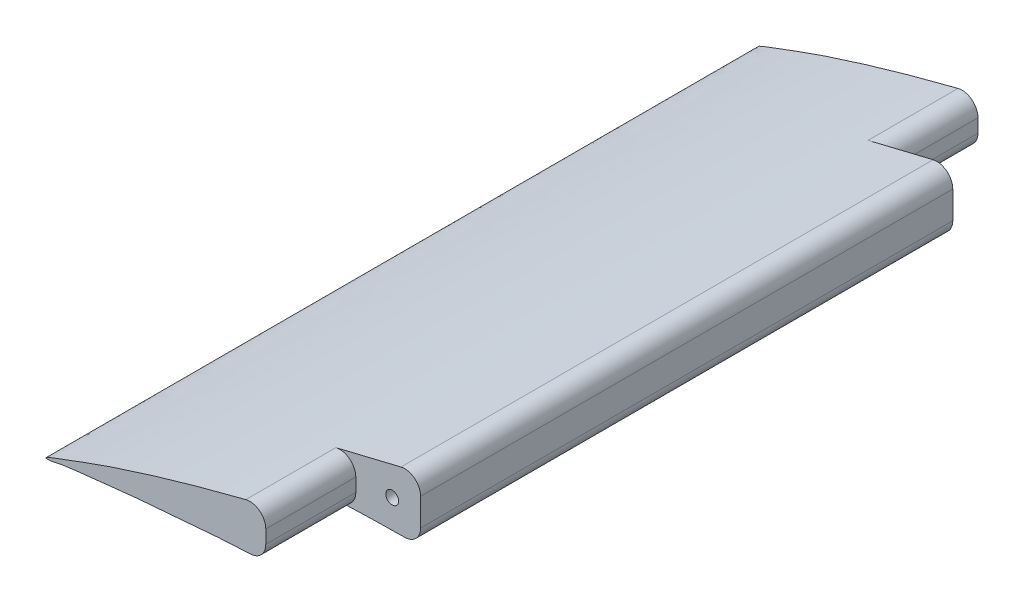
from build123d import *

# Parameters (mm, degrees)
BOSS_EXTRUDE1_DEPTH       = 226.06
CUT_EXTRUDE1_DEPTH        = 248.603669875
CUT_EXTRUDE1_DEPTH_BACK   = 248.603669875
FILLET1_R                 = 5.08
SHELL1_START              = 31.75
SHELL1_DEPTH              = 162.56
SHELL1_START_2            = 3.175
SHELL1_2_DEPTH            = 219.71
SKETCH3_R                 = 2.032
CUT_EXTRUDE2_DEPTH        = 246.233624371
BOSS_EXTRUDE2_START       = -4.025198094
BOSS_EXTRUDE2_OUTLINE_R   = 1.5875
BOSS_EXTRUDE2_DEPTH       = 5.811624811
BOSS_EXTRUDE2_START_2     = -8.955775483
BOSS_EXTRUDE2_2_OUTLINE_R = 1.5875
BOSS_EXTRUDE2_2_DEPTH     = 4.930577389


# Read off the part's stored shape, not the designer's step: Shell1, Boss-Extrude2
with BuildPart() as part:
    # Sketch1 → Boss-Extrude1 (new body)
    with BuildSketch(Plane.XY):
        with BuildLine():
            Line((99.32639085, 18.404394796), (99.32639085, -2.986448862))
            add(Edge.make_bspline(
                [(5.047603806, -9.653713384), (9.482649657, -8.546128483), (16.988483729, -8.076906091), (30.336595099, -6.254410192), (41.946659702, -5.566037344), (65.865842143, -3.231342143), (83.974811725, -3.089086557), (99.32639085, -2.986448862)],
                knots=[0, 0, 0, 0, 0.144322392, 0.237947652, 0.42712275, 0.512831912, 1, 1, 1, 1], degree=3))
            add(Edge.make_bspline(
                [(5.047603806, -9.653713384), (1.304537033, -10.042523479), (11.503328192, -6.353494655), (19.723627138, -3.092777487), (52.915151131, 7.645918304), (77.889766355, 13.460013374), (99.32639085, 18.404394796)],
                knots=[0, 0, 0, 0, 0.059914523, 0.175786391, 0.369274689, 1, 1, 1, 1], degree=3))
        make_face()
    extrude(amount=BOSS_EXTRUDE1_DEPTH)

    # Sketch2 → Cut-Extrude1 (cut, two sides: drawn at the far end of the back side and taken through both)
    with BuildSketch(Plane(origin=(0, 0, 0), x_dir=(1, 0, 0), z_dir=(0, 1, 0)).offset(-CUT_EXTRUDE1_DEPTH_BACK)):
        Polygon((169.681502528, 0), (169.681502528, -226.06), (73.16439085, -226.06), (73.16439085, -197.485), (93.73839085, -197.485), (93.73839085, -28.575), (73.16439085, -28.575), (73.16439085, 0), align=None)
    extrude(amount=CUT_EXTRUDE1_DEPTH + CUT_EXTRUDE1_DEPTH_BACK, mode=Mode.SUBTRACT)

    # Fillet1
    fillet1_edges = [part.edges().sort_by_distance(p)[0] for p in [
        (73.16439085, -3.388889971, 14.2875),
        (73.16439085, 12.236004014, 14.2875),
        (93.73839085, -3.026654485, 113.03),
        (93.73839085, 17.113551214, 113.03),
        (73.16439085, -3.388889971, 211.7725),
        (73.16439085, 12.236004014, 211.7725),
    ]]
    fillet(fillet1_edges, radius=FILLET1_R)

    # Shell1 outline → Shell1 (cut)
    with BuildSketch(Plane.XY.offset(SHELL1_START)):
        with BuildLine():
            ThreePointArc((90.56339085, 10.716231692), (89.84210345, 12.208829924), (88.224441264, 12.571147528))
            add(Edge.make_bspline(
                [(88.224441264, 12.571147528), (87.199954726, 12.331473265), (86.178161178, 12.091844736), (85.158893539, 11.852170354), (84.141984638, 11.612358579), (83.127267128, 11.372317854), (82.11457348, 11.131956606), (81.103735991, 10.891183246), (80.094586779, 10.649906167), (79.086957782, 10.408033746), (78.080680762, 10.165474344), (77.075587303, 9.922136302), (75.365261077, 9.50615692), (74.659515429, 9.333955274), (73.95421322, 9.161291111), (73.24929575, 8.988132524), (72.544704275, 8.814447596), (71.84038, 8.640204402), (71.136264087, 8.465371009), (70.432297655, 8.289915474), (69.728421779, 8.113805846), (69.024577498, 7.937010164), (68.320705808, 7.759496459), (67.616747671, 7.581232754)],
                knots=[0.118068853, 0.118068853, 0.118068853, 0.118068853, 0.118068853, 0.118068853, 0.118068853, 0.118068853, 0.118068853, 0.118068853, 0.118068853, 0.118068853, 0.118068853, 0.242924315, 0.242924315, 0.242924315, 0.242924315, 0.242924315, 0.242924315, 0.242924315, 0.242924315, 0.242924315, 0.242924315, 0.242924315, 0.330745026, 0.330745026, 0.330745026, 0.330745026, 0.330745026, 0.330745026, 0.330745026, 0.330745026, 0.330745026, 0.330745026, 0.330745026, 0.330745026, 0.330745026], degree=12))
            ThreePointArc((67.616747671, 7.581232754), (69.254468773, 7.237834237), (69.98939085, 5.734523672))
            Line((69.98939085, 5.734523672), (69.98939085, 1.506513014))
            ThreePointArc((69.98939085, 1.506513014), (69.459523341, 0.188167221), (68.164681525, -0.396794214))
            add(Edge.make_bspline(
                [(68.164681525, -0.396794214), (68.694992172, -0.374423154), (69.225275053, -0.352727917), (69.755528584, -0.331695291), (70.285751179, -0.311312074), (70.815941255, -0.291565067), (71.346097229, -0.272441078), (71.876217523, -0.25392692), (72.406300557, -0.236009412), (72.936344753, -0.218675382), (73.466348538, -0.201911658), (73.996310335, -0.18570508), (74.526228574, -0.170042489), (75.056101682, -0.154910735), (76.522372139, -0.114466983), (77.45867021, -0.090254504), (78.394813662, -0.06758666), (79.330793845, -0.046390933), (80.266602102, -0.026594862), (81.202229769, -0.008126042), (82.137668173, 0.009087874), (83.072908636, 0.025119175), (84.007942471, 0.040040096), (84.942760983, 0.053922812), (85.87735547, 0.066839443), (86.811717225, 0.07886205), (87.74583753, 0.09006264), (88.679707661, 0.100513159)],
                knots=[0.67202474, 0.67202474, 0.67202474, 0.67202474, 0.67202474, 0.67202474, 0.67202474, 0.67202474, 0.67202474, 0.67202474, 0.67202474, 0.67202474, 0.67202474, 0.67202474, 0.67202474, 0.75, 0.75, 0.75, 0.75, 0.75, 0.75, 0.75, 0.75, 0.75, 0.75, 0.75, 0.75, 0.75, 0.887817721, 0.887817721, 0.887817721, 0.887817721, 0.887817721, 0.887817721, 0.887817721, 0.887817721, 0.887817721, 0.887817721, 0.887817721, 0.887817721, 0.887817721, 0.887817721, 0.887817721], degree=14))
            ThreePointArc((88.679707661, 0.100513159), (90.012944885, 0.665913267), (90.56339085, 2.0053939))
            Line((90.56339085, 2.0053939), (90.56339085, 10.716231692))
        make_face()
        with BuildLine():
            ThreePointArc((69.98939085, 5.734523672), (69.254468773, 7.237834237), (67.616747644, 7.581232862))
            add(Edge.make_bspline(
                [(67.616747644, 7.581232862), (65.399836461, 7.019843113), (63.182067917, 6.451015332), (60.961598132, 5.873750666), (58.736579605, 5.2870495), (56.505161763, 4.689911333), (54.265491496, 4.081334769), (52.015713682, 3.460317509), (49.753971716, 2.825856339), (47.478408044, 2.176947117), (45.187164685, 1.512584769), (42.878383765, 0.831763272), (40.358491497, 0.075974277), (40.166643435, 0.018354472), (39.974662823, -0.039384328), (39.782548624, -0.097242688), (39.590299803, -0.155221168), (39.397915321, -0.213320331), (39.205394144, -0.271540739), (39.012735233, -0.329882954), (38.819937552, -0.388347539), (38.627000064, -0.446935056), (38.433921733, -0.505646067), (38.047481311, -0.6233162), (37.854115889, -0.68227633), (37.660618706, -0.741357704), (37.46700324, -0.800556496), (37.273282999, -0.859868869), (37.079471514, -0.919290978), (36.885582349, -0.97881897), (36.69162909, -1.038448983), (36.497625354, -1.098177145), (36.303584785, -1.157999576), (36.109521054, -1.217912388), (35.527301471, -1.397910273), (35.139116839, -1.518254909), (34.751002758, -1.638914656), (34.363068079, -1.759858551), (33.975421705, -1.881055606), (33.588172595, -2.002474805), (33.20142976, -2.124085105), (32.815302268, -2.245855438), (32.429899238, -2.367754709), (32.045329846, -2.489751794), (31.66170332, -2.611815547), (31.123971117, -2.783433666), (30.968986334, -2.832958389), (30.814181899, -2.882486873), (30.659565113, -2.93201703), (30.505143284, -2.981546776), (30.350923715, -3.031074022), (30.196913716, -3.080596682), (30.043120596, -3.130112665), (29.889551668, -3.179619883), (29.736214245, -3.229116246), (29.583115647, -3.27859966), (29.430263192, -3.328068033)],
                knots=[0.330745026, 0.330745026, 0.330745026, 0.330745026, 0.330745026, 0.330745026, 0.330745026, 0.330745026, 0.330745026, 0.330745026, 0.330745026, 0.330745026, 0.330745026, 0.607310788, 0.607310788, 0.607310788, 0.607310788, 0.607310788, 0.607310788, 0.607310788, 0.607310788, 0.607310788, 0.607310788, 0.607310788, 0.630084943, 0.630084943, 0.630084943, 0.630084943, 0.630084943, 0.630084943, 0.630084943, 0.630084943, 0.630084943, 0.630084943, 0.630084943, 0.652859097, 0.652859097, 0.652859097, 0.652859097, 0.652859097, 0.652859097, 0.652859097, 0.652859097, 0.652859097, 0.652859097, 0.652859097, 0.698407406, 0.698407406, 0.698407406, 0.698407406, 0.698407406, 0.698407406, 0.698407406, 0.698407406, 0.698407406, 0.698407406, 0.698407406, 0.716880093, 0.716880093, 0.716880093, 0.716880093, 0.716880093, 0.716880093, 0.716880093, 0.716880093, 0.716880093, 0.716880093, 0.716880093, 0.716880093, 0.716880093], degree=12))
            add(Edge.make_bspline(
                [(29.430263192, -3.328068033), (30.192321788, -3.253103705), (30.953742852, -3.181055792), (31.714498333, -3.111652976), (32.474560286, -3.044625223), (33.233901052, -2.979703638), (33.992493217, -2.916620464), (34.750309569, -2.855109092), (35.507323058, -2.794904058), (36.26350675, -2.735741051), (37.018833789, -2.677356913), (37.77327735, -2.619489644), (38.526810601, -2.561878406), (39.27940666, -2.504263523), (40.241275886, -2.430197827), (40.451437795, -2.413988578), (40.661523692, -2.397753121), (40.871532992, -2.381485838), (41.081465111, -2.36518111), (41.291319462, -2.34883332), (41.501095461, -2.332436848), (41.710792523, -2.315986075), (41.920410064, -2.299475384), (42.129947497, -2.282899155), (42.339404239, -2.266251771), (42.548779704, -2.249527611), (42.758073307, -2.232721059), (43.071890042, -2.207379213), (43.176475009, -2.198909942), (43.281039293, -2.190417989), (43.38558282, -2.181902656), (43.490105518, -2.173363251), (43.594607315, -2.164799076), (43.699088138, -2.156209439), (43.803547915, -2.147593642), (43.907986571, -2.138950992), (44.012404037, -2.130280793), (44.116800238, -2.12158235), (44.221175102, -2.112854969), (44.325528557, -2.104097954), (44.482026516, -2.090916937), (44.534185416, -2.08651578), (44.586353102, -2.082106088), (44.638462372, -2.077692142), (44.690677468, -2.073262507), (44.74276457, -2.068834253), (44.79486261, -2.064396055), (44.84709011, -2.05993977), (44.899190406, -2.055485443), (44.951182515, -2.051030032), (45.003429676, -2.046545196), (45.055514905, -2.042065555), (45.107662823, -2.037572174), (45.211955574, -2.028569312), (45.264108442, -2.024059127), (45.316267814, -2.019540326), (45.368433702, -2.015013048), (45.42060612, -2.010477431), (45.472785076, -2.005933613), (45.524970589, -2.001381732), (45.577162664, -1.996821927), (45.629361319, -1.992254336), (45.681566563, -1.987679097), (45.73377841, -1.983096348), (45.785996871, -1.978506228), (45.838221958, -1.973908876), (46.3083075, -1.93246885), (46.726586222, -1.895179261), (47.145296128, -1.857506655), (47.564443519, -1.819522312), (47.98403472, -1.781297798), (48.404076086, -1.742904961), (48.824573993, -1.704415937), (49.24553485, -1.665903148), (49.66696508, -1.627439299), (50.088871145, -1.589097383), (50.511259522, -1.550950675), (50.934136722, -1.513072738), (51.357509275, -1.47553742), (51.834368049, -1.433779033), (51.8873602, -1.429145723), (51.940360205, -1.424519069), (51.993368079, -1.419899217), (52.046383832, -1.415286311), (52.099407479, -1.410680497), (52.152439032, -1.40608192), (52.205478504, -1.401490725), (52.258525908, -1.396907058), (52.311581256, -1.392331062), (52.364644562, -1.387762884), (52.417715838, -1.38320267), (52.470795096, -1.378650563), (52.576969604, -1.369562855), (52.630062039, -1.365027462), (52.683179331, -1.360499209), (52.736263003, -1.355982684), (52.78940087, -1.351471194), (52.842545574, -1.346968801), (52.895651993, -1.342479031), (52.948780943, -1.337996995), (53.001972248, -1.333519945), (53.055147327, -1.329054684), (53.108262643, -1.324604451), (53.161436979, -1.320159017), (53.214588182, -1.31572572), (53.37405314, -1.302454763), (53.48036356, -1.293647424), (53.586674415, -1.284879943), (53.692985692, -1.276152212), (53.799297377, -1.267464124), (53.905609457, -1.258815573), (54.011921919, -1.25020645), (54.118234749, -1.241636649), (54.224547934, -1.233106063), (54.330861461, -1.224614583), (54.437175316, -1.216162103), (54.543489487, -1.207748516), (54.649803959, -1.199373714), (54.96874824, -1.174365343), (55.181378913, -1.157847807), (55.394010633, -1.141484125), (55.606643294, -1.125273441), (55.819276791, -1.109214898), (56.031911017, -1.093307639), (56.244545869, -1.077550807), (56.457181238, -1.061943545), (56.669817021, -1.046484998), (56.882453112, -1.031174307), (57.095089404, -1.016010616), (57.307725793, -1.000993068), (57.520362172, -0.986120806), (58.158270965, -0.941937311), (58.583543022, -0.913059346), (59.008813776, -0.884752245), (59.434082397, -0.857009171), (59.859348051, -0.829823289), (60.284609909, -0.803187765), (60.709867137, -0.777095761), (61.135118907, -0.751540443), (61.560364383, -0.726514975), (61.985602738, -0.702012521), (62.410833137, -0.678026246), (62.83605475, -0.654549315), (63.261266746, -0.631574892), (64.006388166, -0.592183223), (64.32630213, -0.575550919), (64.646209835, -0.559196323), (64.96611093, -0.543116532), (65.286005067, -0.527308639), (65.605891895, -0.511769741), (65.925771064, -0.496496937), (66.245642227, -0.481487322), (66.565505034, -0.466737997), (66.885359135, -0.45224606), (67.205204184, -0.438008612), (67.52503983, -0.424022754), (67.844865727, -0.410285587), (68.164681525, -0.396794215)],
                knots=[0.263276283, 0.263276283, 0.263276283, 0.263276283, 0.263276283, 0.263276283, 0.263276283, 0.263276283, 0.263276283, 0.263276283, 0.263276283, 0.263276283, 0.263276283, 0.263276283, 0.263276283, 0.375, 0.375, 0.375, 0.375, 0.375, 0.375, 0.375, 0.375, 0.375, 0.375, 0.375, 0.375, 0.375, 0.40625, 0.40625, 0.40625, 0.40625, 0.40625, 0.40625, 0.40625, 0.40625, 0.40625, 0.40625, 0.40625, 0.40625, 0.40625, 0.421875, 0.421875, 0.421875, 0.421875, 0.421875, 0.421875, 0.421875, 0.421875, 0.421875, 0.421875, 0.421875, 0.421875, 0.421875, 0.4296875, 0.4296875, 0.4296875, 0.4296875, 0.4296875, 0.4296875, 0.4296875, 0.4296875, 0.4296875, 0.4296875, 0.4296875, 0.4296875, 0.4296875, 0.4375, 0.4375, 0.4375, 0.4375, 0.4375, 0.4375, 0.4375, 0.4375, 0.4375, 0.4375, 0.4375, 0.4375, 0.4375, 0.5, 0.5, 0.5, 0.5, 0.5, 0.5, 0.5, 0.5, 0.5, 0.5, 0.5, 0.5, 0.5, 0.5078125, 0.5078125, 0.5078125, 0.5078125, 0.5078125, 0.5078125, 0.5078125, 0.5078125, 0.5078125, 0.5078125, 0.5078125, 0.5078125, 0.5078125, 0.515625, 0.515625, 0.515625, 0.515625, 0.515625, 0.515625, 0.515625, 0.515625, 0.515625, 0.515625, 0.515625, 0.515625, 0.515625, 0.53125, 0.53125, 0.53125, 0.53125, 0.53125, 0.53125, 0.53125, 0.53125, 0.53125, 0.53125, 0.53125, 0.53125, 0.53125, 0.5625, 0.5625, 0.5625, 0.5625, 0.5625, 0.5625, 0.5625, 0.5625, 0.5625, 0.5625, 0.5625, 0.5625, 0.5625, 0.625, 0.625, 0.625, 0.625, 0.625, 0.625, 0.625, 0.625, 0.625, 0.625, 0.625, 0.625, 0.625, 0.67202474, 0.67202474, 0.67202474, 0.67202474, 0.67202474, 0.67202474, 0.67202474, 0.67202474, 0.67202474, 0.67202474, 0.67202474, 0.67202474, 0.67202474, 0.67202474, 0.67202474], degree=14))
            ThreePointArc((68.164681525, -0.396794215), (69.459523341, 0.188167221), (69.98939085, 1.506513014))
            Line((69.98939085, 1.506513014), (69.98939085, 5.734523672))
        make_face()
    extrude(amount=SHELL1_DEPTH, mode=Mode.SUBTRACT)

    # Shell1 2 outline → Shell1 2 (cut)
    with BuildSketch(Plane.XY.offset(SHELL1_START_2)):
        with BuildLine():
            ThreePointArc((69.98939085, 5.734523672), (69.254468773, 7.237834237), (67.616747644, 7.581232862))
            add(Edge.make_bspline(
                [(67.616747644, 7.581232862), (65.399836461, 7.019843113), (63.182067917, 6.451015332), (60.961598132, 5.873750666), (58.736579605, 5.2870495), (56.505161763, 4.689911333), (54.265491496, 4.081334769), (52.015713682, 3.460317509), (49.753971716, 2.825856339), (47.478408044, 2.176947117), (45.187164685, 1.512584769), (42.878383765, 0.831763272), (40.358491497, 0.075974277), (40.166643435, 0.018354472), (39.974662823, -0.039384328), (39.782548624, -0.097242688), (39.590299803, -0.155221168), (39.397915321, -0.213320331), (39.205394144, -0.271540739), (39.012735233, -0.329882954), (38.819937552, -0.388347539), (38.627000064, -0.446935056), (38.433921733, -0.505646067), (38.047481311, -0.6233162), (37.854115889, -0.68227633), (37.660618706, -0.741357704), (37.46700324, -0.800556496), (37.273282999, -0.859868869), (37.079471514, -0.919290978), (36.885582349, -0.97881897), (36.69162909, -1.038448983), (36.497625354, -1.098177145), (36.303584785, -1.157999576), (36.109521054, -1.217912388), (35.527301471, -1.397910273), (35.139116839, -1.518254909), (34.751002758, -1.638914656), (34.363068079, -1.759858551), (33.975421705, -1.881055606), (33.588172595, -2.002474805), (33.20142976, -2.124085105), (32.815302268, -2.245855438), (32.429899238, -2.367754709), (32.045329846, -2.489751794), (31.66170332, -2.611815547), (31.123971117, -2.783433666), (30.968986334, -2.832958389), (30.814181899, -2.882486873), (30.659565113, -2.93201703), (30.505143284, -2.981546776), (30.350923715, -3.031074022), (30.196913716, -3.080596682), (30.043120596, -3.130112665), (29.889551668, -3.179619883), (29.736214245, -3.229116246), (29.583115647, -3.27859966), (29.430263192, -3.328068033)],
                knots=[0.330745026, 0.330745026, 0.330745026, 0.330745026, 0.330745026, 0.330745026, 0.330745026, 0.330745026, 0.330745026, 0.330745026, 0.330745026, 0.330745026, 0.330745026, 0.607310788, 0.607310788, 0.607310788, 0.607310788, 0.607310788, 0.607310788, 0.607310788, 0.607310788, 0.607310788, 0.607310788, 0.607310788, 0.630084943, 0.630084943, 0.630084943, 0.630084943, 0.630084943, 0.630084943, 0.630084943, 0.630084943, 0.630084943, 0.630084943, 0.630084943, 0.652859097, 0.652859097, 0.652859097, 0.652859097, 0.652859097, 0.652859097, 0.652859097, 0.652859097, 0.652859097, 0.652859097, 0.652859097, 0.698407406, 0.698407406, 0.698407406, 0.698407406, 0.698407406, 0.698407406, 0.698407406, 0.698407406, 0.698407406, 0.698407406, 0.698407406, 0.716880093, 0.716880093, 0.716880093, 0.716880093, 0.716880093, 0.716880093, 0.716880093, 0.716880093, 0.716880093, 0.716880093, 0.716880093, 0.716880093, 0.716880093], degree=12))
            add(Edge.make_bspline(
                [(29.430263192, -3.328068033), (30.192321788, -3.253103705), (30.953742852, -3.181055792), (31.714498333, -3.111652976), (32.474560286, -3.044625223), (33.233901052, -2.979703638), (33.992493217, -2.916620464), (34.750309569, -2.855109092), (35.507323058, -2.794904058), (36.26350675, -2.735741051), (37.018833789, -2.677356913), (37.77327735, -2.619489644), (38.526810601, -2.561878406), (39.27940666, -2.504263523), (40.241275886, -2.430197827), (40.451437795, -2.413988578), (40.661523692, -2.397753121), (40.871532992, -2.381485838), (41.081465111, -2.36518111), (41.291319462, -2.34883332), (41.501095461, -2.332436848), (41.710792523, -2.315986075), (41.920410064, -2.299475384), (42.129947497, -2.282899155), (42.339404239, -2.266251771), (42.548779704, -2.249527611), (42.758073307, -2.232721059), (43.071890042, -2.207379213), (43.176475009, -2.198909942), (43.281039293, -2.190417989), (43.38558282, -2.181902656), (43.490105518, -2.173363251), (43.594607315, -2.164799076), (43.699088138, -2.156209439), (43.803547915, -2.147593642), (43.907986571, -2.138950992), (44.012404037, -2.130280793), (44.116800238, -2.12158235), (44.221175102, -2.112854969), (44.325528557, -2.104097954), (44.482026516, -2.090916937), (44.534185416, -2.08651578), (44.586353102, -2.082106088), (44.638462372, -2.077692142), (44.690677468, -2.073262507), (44.74276457, -2.068834253), (44.79486261, -2.064396055), (44.84709011, -2.05993977), (44.899190406, -2.055485443), (44.951182515, -2.051030032), (45.003429676, -2.046545196), (45.055514905, -2.042065555), (45.107662823, -2.037572174), (45.211955574, -2.028569312), (45.264108442, -2.024059127), (45.316267814, -2.019540326), (45.368433702, -2.015013048), (45.42060612, -2.010477431), (45.472785076, -2.005933613), (45.524970589, -2.001381732), (45.577162664, -1.996821927), (45.629361319, -1.992254336), (45.681566563, -1.987679097), (45.73377841, -1.983096348), (45.785996871, -1.978506228), (45.838221958, -1.973908876), (46.3083075, -1.93246885), (46.726586222, -1.895179261), (47.145296128, -1.857506655), (47.564443519, -1.819522312), (47.98403472, -1.781297798), (48.404076086, -1.742904961), (48.824573993, -1.704415937), (49.24553485, -1.665903148), (49.66696508, -1.627439299), (50.088871145, -1.589097383), (50.511259522, -1.550950675), (50.934136722, -1.513072738), (51.357509275, -1.47553742), (51.834368049, -1.433779033), (51.8873602, -1.429145723), (51.940360205, -1.424519069), (51.993368079, -1.419899217), (52.046383832, -1.415286311), (52.099407479, -1.410680497), (52.152439032, -1.40608192), (52.205478504, -1.401490725), (52.258525908, -1.396907058), (52.311581256, -1.392331062), (52.364644562, -1.387762884), (52.417715838, -1.38320267), (52.470795096, -1.378650563), (52.576969604, -1.369562855), (52.630062039, -1.365027462), (52.683179331, -1.360499209), (52.736263003, -1.355982684), (52.78940087, -1.351471194), (52.842545574, -1.346968801), (52.895651993, -1.342479031), (52.948780943, -1.337996995), (53.001972248, -1.333519945), (53.055147327, -1.329054684), (53.108262643, -1.324604451), (53.161436979, -1.320159017), (53.214588182, -1.31572572), (53.37405314, -1.302454763), (53.48036356, -1.293647424), (53.586674415, -1.284879943), (53.692985692, -1.276152212), (53.799297377, -1.267464124), (53.905609457, -1.258815573), (54.011921919, -1.25020645), (54.118234749, -1.241636649), (54.224547934, -1.233106063), (54.330861461, -1.224614583), (54.437175316, -1.216162103), (54.543489487, -1.207748516), (54.649803959, -1.199373714), (54.96874824, -1.174365343), (55.181378913, -1.157847807), (55.394010633, -1.141484125), (55.606643294, -1.125273441), (55.819276791, -1.109214898), (56.031911017, -1.093307639), (56.244545869, -1.077550807), (56.457181238, -1.061943545), (56.669817021, -1.046484998), (56.882453112, -1.031174307), (57.095089404, -1.016010616), (57.307725793, -1.000993068), (57.520362172, -0.986120806), (58.158270965, -0.941937311), (58.583543022, -0.913059346), (59.008813776, -0.884752245), (59.434082397, -0.857009171), (59.859348051, -0.829823289), (60.284609909, -0.803187765), (60.709867137, -0.777095761), (61.135118907, -0.751540443), (61.560364383, -0.726514975), (61.985602738, -0.702012521), (62.410833137, -0.678026246), (62.83605475, -0.654549315), (63.261266746, -0.631574892), (64.006388166, -0.592183223), (64.32630213, -0.575550919), (64.646209835, -0.559196323), (64.96611093, -0.543116532), (65.286005067, -0.527308639), (65.605891895, -0.511769741), (65.925771064, -0.496496937), (66.245642227, -0.481487322), (66.565505034, -0.466737997), (66.885359135, -0.45224606), (67.205204184, -0.438008612), (67.52503983, -0.424022754), (67.844865727, -0.410285587), (68.164681525, -0.396794215)],
                knots=[0.263276283, 0.263276283, 0.263276283, 0.263276283, 0.263276283, 0.263276283, 0.263276283, 0.263276283, 0.263276283, 0.263276283, 0.263276283, 0.263276283, 0.263276283, 0.263276283, 0.263276283, 0.375, 0.375, 0.375, 0.375, 0.375, 0.375, 0.375, 0.375, 0.375, 0.375, 0.375, 0.375, 0.375, 0.40625, 0.40625, 0.40625, 0.40625, 0.40625, 0.40625, 0.40625, 0.40625, 0.40625, 0.40625, 0.40625, 0.40625, 0.40625, 0.421875, 0.421875, 0.421875, 0.421875, 0.421875, 0.421875, 0.421875, 0.421875, 0.421875, 0.421875, 0.421875, 0.421875, 0.421875, 0.4296875, 0.4296875, 0.4296875, 0.4296875, 0.4296875, 0.4296875, 0.4296875, 0.4296875, 0.4296875, 0.4296875, 0.4296875, 0.4296875, 0.4296875, 0.4375, 0.4375, 0.4375, 0.4375, 0.4375, 0.4375, 0.4375, 0.4375, 0.4375, 0.4375, 0.4375, 0.4375, 0.4375, 0.5, 0.5, 0.5, 0.5, 0.5, 0.5, 0.5, 0.5, 0.5, 0.5, 0.5, 0.5, 0.5, 0.5078125, 0.5078125, 0.5078125, 0.5078125, 0.5078125, 0.5078125, 0.5078125, 0.5078125, 0.5078125, 0.5078125, 0.5078125, 0.5078125, 0.5078125, 0.515625, 0.515625, 0.515625, 0.515625, 0.515625, 0.515625, 0.515625, 0.515625, 0.515625, 0.515625, 0.515625, 0.515625, 0.515625, 0.53125, 0.53125, 0.53125, 0.53125, 0.53125, 0.53125, 0.53125, 0.53125, 0.53125, 0.53125, 0.53125, 0.53125, 0.53125, 0.5625, 0.5625, 0.5625, 0.5625, 0.5625, 0.5625, 0.5625, 0.5625, 0.5625, 0.5625, 0.5625, 0.5625, 0.5625, 0.625, 0.625, 0.625, 0.625, 0.625, 0.625, 0.625, 0.625, 0.625, 0.625, 0.625, 0.625, 0.625, 0.67202474, 0.67202474, 0.67202474, 0.67202474, 0.67202474, 0.67202474, 0.67202474, 0.67202474, 0.67202474, 0.67202474, 0.67202474, 0.67202474, 0.67202474, 0.67202474, 0.67202474], degree=14))
            ThreePointArc((68.164681525, -0.396794215), (69.459523341, 0.188167221), (69.98939085, 1.506513014))
            Line((69.98939085, 1.506513014), (69.98939085, 5.734523672))
        make_face()
    extrude(amount=SHELL1_2_DEPTH, mode=Mode.SUBTRACT)

    # Sketch3 → Cut-Extrude2 (cut, through all)
    with BuildSketch(Plane.XY):
        with Locations((84.713563037, 5.874854857)):
            Circle(SKETCH3_R)
    extrude(amount=CUT_EXTRUDE2_DEPTH, mode=Mode.SUBTRACT)

    # Boss-Extrude2 outline → Boss-Extrude2 (add)
    with BuildSketch(Plane(origin=(0, 0.100513169, 0), x_dir=(0, 0, 1), z_dir=(0, -1, 0)).offset(BOSS_EXTRUDE2_START)):
        with Locations((50.8, -50.615235316)):
            Circle(BOSS_EXTRUDE2_OUTLINE_R)
        with Locations((126.965977315, -52.892053199)):
            Circle(BOSS_EXTRUDE2_OUTLINE_R)
        with Locations((203.16597731, -52.892933198)):
            Circle(BOSS_EXTRUDE2_OUTLINE_R)
        with Locations((76.2, -69.665235316)):
            Circle(BOSS_EXTRUDE2_OUTLINE_R)
        with Locations((152.365977315, -71.942053199)):
            Circle(BOSS_EXTRUDE2_OUTLINE_R)
    extrude(amount=BOSS_EXTRUDE2_DEPTH)

    # Boss-Extrude2 2 outline → Boss-Extrude2 2 (add)
    with BuildSketch(Plane(origin=(0, 0.100513169, 0), x_dir=(0, 0, 1), z_dir=(0, -1, 0)).offset(BOSS_EXTRUDE2_START_2)):
        with Locations((76.2, -69.665235316)):
            Circle(BOSS_EXTRUDE2_2_OUTLINE_R)
        with Locations((152.365977315, -71.942053199)):
            Circle(BOSS_EXTRUDE2_2_OUTLINE_R)
    extrude(amount=BOSS_EXTRUDE2_2_DEPTH)


solid = part.part
